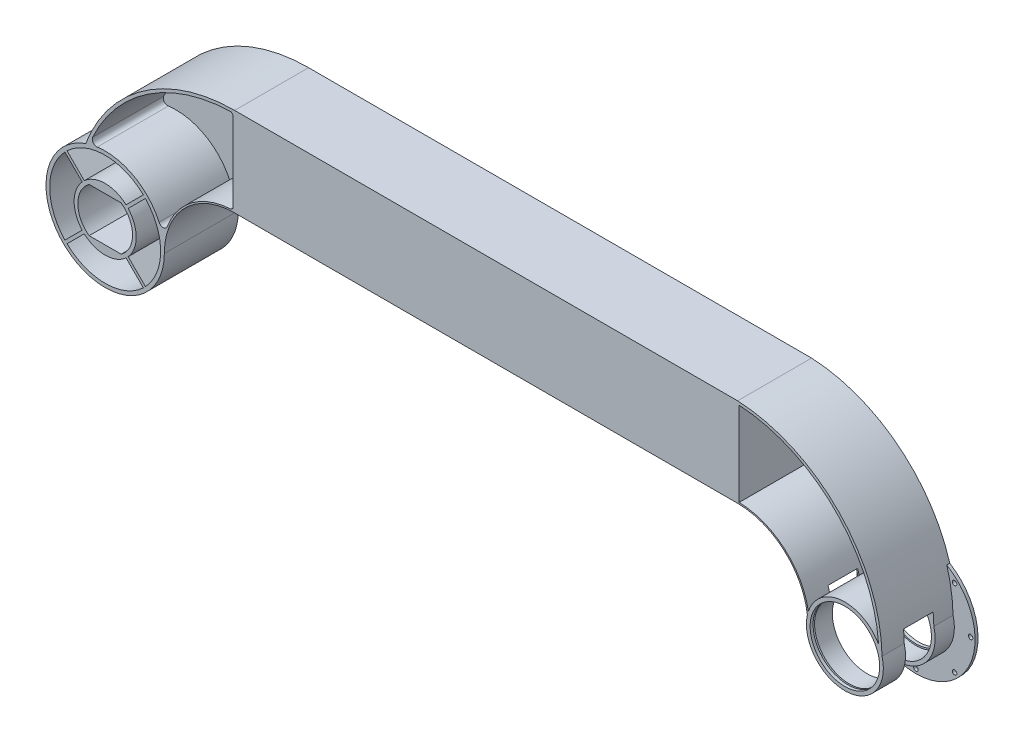
from build123d import *
from build123d.topology import SkipClean

# Parameters (mm, degrees)
BOSS_EXTRUDE1_DEPTH             = 1
BOSS_EXTRUDE2_DEPTH             = 25
SKETCH1_11_R                    = 40
SKETCH1_11_R_2                  = 37.5
SKETCH1_11_R_3                  = 21
BOSS_EXTRUDE3_DEPTH             = 2
SKETCH1_12_R                    = 21
SKETCH1_12_R_2                  = 15
BOSS_EXTRUDE4_DEPTH             = 25
SKETCH1_13_R                    = 40
SKETCH1_13_R_2                  = 37.5
BOSS_EXTRUDE5_DEPTH             = 25
BOSS_EXTRUDE6_START             = -2
SKETCH1_14_R                    = 40
SKETCH1_14_R_2                  = 21
BOSS_EXTRUDE6_DEPTH             = 3
SKETCH1_15_R                    = 23.5
SKETCH1_15_R_2                  = 21
BOSS_EXTRUDE7_DEPTH             = 14
SKETCH1_16_R                    = 40
SKETCH1_16_R_2                  = 23.5
BOSS_EXTRUDE8_DEPTH             = 14
SKETCH1_17_R                    = 37.5
SKETCH1_17_R_2                  = 21
CUT_EXTRUDE1_DEPTH              = 2
SKETCH3_R                       = 31
CUT_EXTRUDE2_DEPTH              = 22
CUT_EXTRUDE4_START              = 1
CUT_EXTRUDE4_DEPTH              = 1
BOSS_EXTRUDE9_START             = 50
BOSS_EXTRUDE9_DEPTH             = 50
BOSS_EXTRUDE10_START            = 50
BOSS_EXTRUDE10_DEPTH            = 50
CUT_EXTRUDE8_DEPTH              = 60
CUT_EXTRUDE8_DEPTH_BACK         = 60
SKETCH6_W                       = 248.929499316
SKETCH6_H                       = 245.601683372
SKETCH7_R                       = 23.5
BOSS_EXTRUDE11_DEPTH            = 50
SKETCH7_23_W                    = 340
SKETCH7_23_H                    = 57
BOSS_EXTRUDE12_DEPTH            = 1
SKETCH10_W                      = 1
SKETCH10_H                      = 57
BOSS_EXTRUDE13_DEPTH            = 15
BOSS_EXTRUDE14_DEPTH            = 2
CUT_EXTRUDE9_START              = 62
CUT_EXTRUDE9_DEPTH              = 62
BOSS_EXTRUDE15_START            = 2
BOSS_EXTRUDE15_DEPTH            = 2
SKETCH7_27_R                    = 37.5
SKETCH7_27_R_2                  = 21
CUT_EXTRUDE10_DEPTH             = 60
SKETCH7_28_R                    = 37.5
SKETCH7_28_R_2                  = 21
BOSS_EXTRUDE16_DEPTH            = 2
FILLET7_R                       = 3
FILLET8_R                       = 2
RIB2_START                      = -48
RIB2_DEPTH                      = 48
SKETCH16_R                      = 5
CUT_EXTRUDE12_DEPTH             = 10
SKETCH17_R                      = 40
SKETCH17_R_2                    = 22.5
BOSS_EXTRUDE17_DEPTH            = 2
SKETCH24_R                      = 26
SKETCH24_R_2                    = 23.5
BOSS_EXTRUDE18_DEPTH            = 50
F_3_0MM_DOWEL_HOLE2_D           = 3
F_3_0MM_DOWEL_HOLE2_CSINK_D     = 3.05
F_3_0MM_DOWEL_HOLE2_CSINK_ANGLE = 90
CUT_EXTRUDE13_DEPTH             = 50
CUT_EXTRUDE11_DEPTH             = 15
CUT_EXTRUDE11_DEPTH_BACK        = 40
SKETCH11_W                      = 120
SKETCH11_H                      = 20
SKETCH25_R                      = 25
CUT_EXTRUDE14_DEPTH             = 1


# Read off the part's stored shape, not the designer's step: Rib2
with BuildPart() as part:
    # Sketch1 → Boss-Extrude1 (new body)
    with BuildSketch(Plane.XY):
        with BuildLine():
            ThreePointArc((87.5, 105.5), (28.068160961, 87.167118275), (-10.708571429, 38.539933808))
            ThreePointArc((-10.708571429, 38.539933808), (21.483664092, 33.740956969), (39.451428571, 6.601877284))
            ThreePointArc((39.451428571, 6.601877284), (55.624782732, 36.554350277), (87.5, 48.5))
            Line((87.5, 48.5), (412.5, 48.5))
            ThreePointArc((412.5, 48.5), (444.375217268, 36.554350277), (460.548571429, 6.601877284))
            ThreePointArc((460.548571429, 6.601877284), (478.516335908, 33.740956969), (510.708571429, 38.539933808))
            ThreePointArc((510.708571429, 38.539933808), (471.931839039, 87.167118275), (412.5, 105.5))
            Line((412.5, 105.5), (87.5, 105.5))
        make_face()
        with BuildLine():
            ThreePointArc((39.451428571, 6.601877284), (39.862621231, 3.312314685), (40, 0))
            ThreePointArc((40, 0), (53.912427894, 33.587572106), (87.5, 47.5))
            Line((87.5, 47.5), (412.5, 47.5))
            ThreePointArc((412.5, 47.5), (446.087572106, 33.587572106), (460, 0))
            ThreePointArc((460, 0), (460.137378769, 3.312314685), (460.548571429, 6.601877284))
            ThreePointArc((460.548571429, 6.601877284), (444.375217268, 36.554350277), (412.5, 48.5))
            Line((412.5, 48.5), (87.5, 48.5))
            ThreePointArc((87.5, 48.5), (55.624782732, 36.554350277), (39.451428571, 6.601877284))
        make_face()
    boss_extrude1 = extrude(amount=BOSS_EXTRUDE1_DEPTH)

    # Sketch1<10> → Boss-Extrude2 (add)
    with BuildSketch(Plane.XY):
        with BuildLine():
            Line((412.5, 107.5), (87.5, 107.5))
            ThreePointArc((87.5, 107.5), (26.283214045, 88.367160854), (-13.142857143, 37.779164974))
            ThreePointArc((-13.142857143, 37.779164974), (-11.931779144, 38.178955545), (-10.708571429, 38.539933808))
            ThreePointArc((-10.708571429, 38.539933808), (28.068160961, 87.167118275), (87.5, 105.5))
            Line((87.5, 105.5), (412.5, 105.5))
            ThreePointArc((412.5, 105.5), (471.931839039, 87.167118275), (510.708571429, 38.539933808))
            ThreePointArc((510.708571429, 38.539933808), (511.931779144, 38.178955545), (513.142857143, 37.779164974))
            ThreePointArc((513.142857143, 37.779164974), (473.716785955, 88.367160854), (412.5, 107.5))
        make_face()
        with BuildLine():
            ThreePointArc((39.451428571, 6.601877284), (39.862621231, 3.312314685), (40, 0))
            ThreePointArc((40, 0), (53.912427894, 33.587572106), (87.5, 47.5))
            Line((87.5, 47.5), (412.5, 47.5))
            ThreePointArc((412.5, 47.5), (446.087572106, 33.587572106), (460, 0))
            ThreePointArc((460, 0), (460.137378769, 3.312314685), (460.548571429, 6.601877284))
            ThreePointArc((460.548571429, 6.601877284), (444.375217268, 36.554350277), (412.5, 48.5))
            Line((412.5, 48.5), (87.5, 48.5))
            ThreePointArc((87.5, 48.5), (55.624782732, 36.554350277), (39.451428571, 6.601877284))
        make_face()
    boss_extrude2 = extrude(amount=BOSS_EXTRUDE2_DEPTH)

    # Sketch1<11> → Boss-Extrude3 (add)
    # profile 1 of 2: a face of its own
    with BuildSketch(Plane.XY):
        Circle(SKETCH1_11_R)
        Circle(SKETCH1_11_R_2, mode=Mode.SUBTRACT)
    # profile 2 of 2: a face of its own
    with BuildSketch(Plane.XY):
        Circle(SKETCH1_11_R_2)
        Circle(SKETCH1_11_R_3, mode=Mode.SUBTRACT)
    boss_extrude3 = extrude(amount=BOSS_EXTRUDE3_DEPTH)

    # Sketch1<12> → Boss-Extrude4 (add)
    with BuildSketch(Plane.XY):
        Circle(SKETCH1_12_R)
        Circle(SKETCH1_12_R_2, mode=Mode.SUBTRACT)
    boss_extrude4 = extrude(amount=BOSS_EXTRUDE4_DEPTH)

    # Sketch1<13> → Boss-Extrude5 (add)
    with BuildSketch(Plane.XY):
        Circle(SKETCH1_13_R)
        Circle(SKETCH1_13_R_2, mode=Mode.SUBTRACT)
    boss_extrude5 = extrude(amount=BOSS_EXTRUDE5_DEPTH)

    # Sketch1<14> → Boss-Extrude6 (add)
    with BuildSketch(Plane.XY.offset(BOSS_EXTRUDE6_START)):
        with Locations((500, 0)):
            Circle(SKETCH1_14_R)
        with Locations((500, 0)):
            Circle(SKETCH1_14_R_2, mode=Mode.SUBTRACT)
    boss_extrude6 = extrude(amount=BOSS_EXTRUDE6_DEPTH)

    # Sketch1<15> → Boss-Extrude7 (add)
    with BuildSketch(Plane.XY):
        with Locations((500, 0)):
            Circle(SKETCH1_15_R)
        with Locations((500, 0)):
            Circle(SKETCH1_15_R_2, mode=Mode.SUBTRACT)
    boss_extrude7 = extrude(amount=BOSS_EXTRUDE7_DEPTH)

    # Sketch1<16> → Boss-Extrude8 (add)
    with BuildSketch(Plane.XY):
        with Locations((500, 0)):
            Circle(SKETCH1_16_R)
        with Locations((500, 0)):
            Circle(SKETCH1_16_R_2, mode=Mode.SUBTRACT)
    boss_extrude8 = extrude(amount=BOSS_EXTRUDE8_DEPTH)

    # Mirror1: Boss-Extrude2, Boss-Extrude3, Boss-Extrude4, Boss-Extrude5, Boss-Extrude6, Boss-Extrude7, Boss-Extrude8 across plane
    add(boss_extrude2.mirror(Plane.XY.offset(25)))
    add(boss_extrude3.mirror(Plane.XY.offset(25)))
    add(boss_extrude4.mirror(Plane.XY.offset(25)))
    add(boss_extrude5.mirror(Plane.XY.offset(25)))
    add(boss_extrude6.mirror(Plane.XY.offset(25)))
    add(boss_extrude7.mirror(Plane.XY.offset(25)))
    add(boss_extrude8.mirror(Plane.XY.offset(25)))

    # Mirror2: Boss-Extrude1 across plane
    add(boss_extrude1.mirror(Plane.XY.offset(25)))

    # Sketch1<17> → Cut-Extrude1 (cut)
    with BuildSketch(Plane.XY):
        with Locations(Location((0, 0, 0), (0, 0, 180))):
            Circle(SKETCH1_17_R)
        with Locations(Location((0, 0, 0), (0, 0, 180))):
            Circle(SKETCH1_17_R_2, mode=Mode.SUBTRACT)
    extrude(amount=CUT_EXTRUDE1_DEPTH, mode=Mode.SUBTRACT)

    # Sketch3 → Cut-Extrude2 (cut)
    with BuildSketch(Plane.XY):
        with Locations((500, 0)):
            Circle(SKETCH3_R)
    extrude(amount=CUT_EXTRUDE2_DEPTH, mode=Mode.SUBTRACT)

    # Sketch5 → Cut-Extrude4 (cut)
    with BuildSketch(Plane.XY.offset(CUT_EXTRUDE4_START)):
        with BuildLine():
            ThreePointArc((510.708571429, 38.539933808), (472.344290507, 86.884468657), (413.5, 105.495260557))
            Line((413.5, 105.495260557), (413.5, 48.489689626))
            ThreePointArc((413.5, 48.489689626), (444.750392176, 36.223779545), (460.548571429, 6.601877284))
            ThreePointArc((460.548571429, 6.601877284), (478.516335908, 33.740956969), (510.708571429, 38.539933808))
        make_face()
        with BuildLine():
            ThreePointArc((86.5, 105.495260557), (27.655709493, 86.884468657), (-10.708571429, 38.539933808))
            ThreePointArc((-10.708571429, 38.539933808), (21.483664092, 33.740956969), (39.451428571, 6.601877284))
            ThreePointArc((39.451428571, 6.601877284), (55.249607824, 36.223779545), (86.5, 48.489689626))
            Line((86.5, 48.489689626), (86.5, 105.495260557))
        make_face()
    extrude(amount=-CUT_EXTRUDE4_DEPTH, mode=Mode.SUBTRACT)

    # Sketch5<19> → Boss-Extrude9 (add)
    with BuildSketch(Plane.XY.offset(BOSS_EXTRUDE9_START)):
        with BuildLine():
            Line((87.5, 48.5), (87.5, 105.5))
            ThreePointArc((87.5, 105.5), (86.999994384, 105.498815133), (86.5, 105.495260557))
            Line((86.5, 105.495260557), (86.5, 48.489689626))
            ThreePointArc((86.5, 48.489689626), (86.999973425, 48.497422338), (87.5, 48.5))
        make_face()
        with BuildLine():
            ThreePointArc((413.5, 105.495260557), (413.000005616, 105.498815133), (412.5, 105.5))
            Line((412.5, 105.5), (412.5, 48.5))
            ThreePointArc((412.5, 48.5), (413.000026575, 48.497422338), (413.5, 48.489689626))
            Line((413.5, 48.489689626), (413.5, 105.495260557))
        make_face()
    extrude(amount=-BOSS_EXTRUDE9_DEPTH)

    # Sketch1<18> → Boss-Extrude10 (add)
    with BuildSketch(Plane.XY.offset(BOSS_EXTRUDE10_START)):
        with BuildLine():
            Line((-7.483314774, 13), (0, 13))
            Line((0, 13), (7.483314774, 13))
            ThreePointArc((7.483314774, 13), (0, 15), (-7.483314774, 13))
        make_face()
        with BuildLine():
            Line((0, -13), (-7.483314774, -13))
            ThreePointArc((-7.483314774, -13), (0, -15), (7.483314774, -13))
            Line((7.483314774, -13), (0, -13))
        make_face()
    extrude(amount=-BOSS_EXTRUDE10_DEPTH)

    # Sketch6 → Cut-Extrude8 (cut, two sides: drawn at the far end of the back side and taken through both)
    with BuildSketch(Plane.XY.offset(-CUT_EXTRUDE8_DEPTH_BACK)):
        with Locations((536.964749658, 15.651167598)):
            Rectangle(SKETCH6_W, SKETCH6_H)
    extrude(amount=CUT_EXTRUDE8_DEPTH + CUT_EXTRUDE8_DEPTH_BACK, mode=Mode.SUBTRACT)

    # Sketch7 → Boss-Extrude11 (add)
    with BuildSketch(Plane.XY):
        with BuildLine():
            Line((427.5, 107.5), (412.5, 107.5))
            Line((412.5, 107.5), (412.5, 105.5))
            Line((412.5, 105.5), (427.5, 105.5))
            Line((427.5, 105.5), (427.5, 48.5))
            Line((427.5, 48.5), (412.5, 48.5))
            Line((412.5, 48.5), (412.5, 47.5))
            Line((412.5, 47.5), (427.5, 47.5))
            ThreePointArc((427.5, 47.5), (461.087572106, 33.587572106), (475, 0))
            ThreePointArc((475, 0), (500, -25), (525, 0))
            ThreePointArc((525, 0), (498.513978978, 73.942911166), (427.5, 107.5))
        make_face()
        with BuildLine():
            ThreePointArc((523.011089442, 9.771886344), (497.865985258, 24.908753102), (475.662068966, 5.715340144))
            ThreePointArc((475.662068966, 5.715340144), (460.082794534, 35.925081772), (428.5, 48.489689626))
            Line((428.5, 48.489689626), (428.5, 105.445258723))
            ThreePointArc((428.5, 105.445258723), (494.085624179, 75.715969985), (523.011089442, 9.771886344))
        make_face(mode=Mode.SUBTRACT)
        with Locations((500, 0)):
            Circle(SKETCH7_R, mode=Mode.SUBTRACT)
    extrude(amount=BOSS_EXTRUDE11_DEPTH)

    # Sketch7<23> → Boss-Extrude12 (add)
    with BuildSketch(Plane.XY):
        with Locations((257.5, 77)):
            Rectangle(SKETCH7_23_W, SKETCH7_23_H)
        with BuildLine():
            Line((428.5, 48.489689626), (428.5, 105.445258723))
            ThreePointArc((428.5, 105.445258723), (428.000068104, 105.473873474), (427.5, 105.5))
            Line((427.5, 105.5), (427.5, 48.5))
            ThreePointArc((427.5, 48.5), (428.000026575, 48.497422338), (428.5, 48.489689626))
        make_face()
    extrude(amount=BOSS_EXTRUDE12_DEPTH)

    # Sketch10 → Boss-Extrude13 (add)
    with BuildSketch(Plane(origin=(412.5, 0, 0), x_dir=(0, 0, -1), z_dir=(1, 0, 0))):
        with Locations((-49.5, 77)):
            Rectangle(SKETCH10_W, SKETCH10_H)
    extrude(amount=BOSS_EXTRUDE13_DEPTH)

    # Sketch7<24> → Boss-Extrude14 (add)
    with BuildSketch(Plane.XY):
        with BuildLine():
            ThreePointArc((475.662068966, 5.715340144), (497.865985258, 24.908753102), (523.011089442, 9.771886344))
            ThreePointArc((523.011089442, 9.771886344), (494.085624179, 75.715969985), (428.5, 105.445258723))
            Line((428.5, 105.445258723), (428.5, 48.489689626))
            ThreePointArc((428.5, 48.489689626), (460.082794534, 35.925081772), (475.662068966, 5.715340144))
        make_face()
    extrude(amount=BOSS_EXTRUDE14_DEPTH)

    # Sketch7<25> → Cut-Extrude9 (cut)
    with BuildSketch(Plane.XY.offset(CUT_EXTRUDE9_START)):
        with BuildLine():
            ThreePointArc((86.5, 105.495260557), (27.655709493, 86.884468657), (-10.708571429, 38.539933808))
            ThreePointArc((-10.708571429, 38.539933808), (21.483664092, 33.740956969), (39.451428571, 6.601877284))
            ThreePointArc((39.451428571, 6.601877284), (55.249607824, 36.223779545), (86.5, 48.489689626))
            Line((86.5, 48.489689626), (86.5, 105.495260557))
        make_face()
    extrude(amount=-CUT_EXTRUDE9_DEPTH, mode=Mode.SUBTRACT)

    # Sketch7<26> → Boss-Extrude15 (add)
    with BuildSketch(Plane.XY.offset(BOSS_EXTRUDE15_START)):
        with BuildLine():
            ThreePointArc((86.5, 105.495260557), (27.655709493, 86.884468657), (-10.708571429, 38.539933808))
            ThreePointArc((-10.708571429, 38.539933808), (21.483664092, 33.740956969), (39.451428571, 6.601877284))
            ThreePointArc((39.451428571, 6.601877284), (55.249607824, 36.223779545), (86.5, 48.489689626))
            Line((86.5, 48.489689626), (86.5, 105.495260557))
        make_face()
    extrude(amount=-BOSS_EXTRUDE15_DEPTH)

    # Sketch7<27> → Cut-Extrude10 (cut)
    with SkipClean():  # the faces are left unmerged after this step: merging them gives an invalid solid
        with BuildSketch(Plane.XY):
            with Locations(Location((0, 0, 0), (0, 0, 180))):
                Circle(SKETCH7_27_R)
            with Locations(Location((0, 0, 0), (0, 0, 180))):
                Circle(SKETCH7_27_R_2, mode=Mode.SUBTRACT)
        extrude(amount=CUT_EXTRUDE10_DEPTH, mode=Mode.SUBTRACT)
    add(part.part.scale(1), mode=Mode.REPLACE)  # the faces are merged on a copy


with BuildPart() as cut_extrude10_piece_1:
    # of the separate pieces the step leaves, piece 1, a body of its own (cut_extrude10_pieces)
    add(part.part.solids().sort_by_distance((87.5, 107.5, 50))[0])



with BuildPart() as cut_extrude10_piece_2:
    # of the separate pieces the step leaves, piece 2, a body of its own (cut_extrude10_pieces)
    add(part.part.solids().sort_by_distance((-21, 0, 50))[0])


with BuildPart() as cut_extrude10_piece_1_1:
    add(cut_extrude10_piece_1.part)

    add(cut_extrude10_piece_2.part)  # Boss-Extrude16 merges Cut-Extrude10 piece 2
    # Sketch7<28> → Boss-Extrude16 (add)
    with BuildSketch(Plane.XY):
        with Locations(Location((0, 0, 0), (0, 0, 180))):
            Circle(SKETCH7_28_R)
        with Locations(Location((0, 0, 0), (0, 0, 180))):
            Circle(SKETCH7_28_R_2, mode=Mode.SUBTRACT)
    extrude(amount=BOSS_EXTRUDE16_DEPTH)

    # Fillet7
    fillet7_edges = [cut_extrude10_piece_1_1.edges().sort_by_distance(p)[0] for p in [
        (-10.708571429, 38.539933808, 26),
        (39.451428571, 6.601877284, 26),
    ]]
    fillet(fillet7_edges, radius=FILLET7_R)

    # Fillet8
    fillet8_edges = [cut_extrude10_piece_1_1.edges().sort_by_distance(p)[0] for p in [
        (86.5, 48.489689626, 26),
        (86.5, 105.495260557, 26),
    ]]
    fillet(fillet8_edges, radius=FILLET8_R)

    # Rib2 outline → Rib2 (add)
    with BuildSketch(Plane.XY.offset(50).offset(RIB2_START)):
        with BuildLine():
            ThreePointArc((-25.799967746, 27.214181309), (-26.516504294, 26.516504294), (-27.214181309, 25.799967746))
            Line((-27.214181309, 25.799967746), (-15.539503755, 14.125290193))
            ThreePointArc((-15.539503755, 14.125290193), (-14.849242405, 14.849242405), (-14.125290193, 15.539503755))
            Line((-14.125290193, 15.539503755), (-25.799967746, 27.214181309))
        make_face()
        with BuildLine():
            Line((-15.539503755, -14.125290193), (-27.214181309, -25.799967746))
            ThreePointArc((-27.214181309, -25.799967746), (-26.516504294, -26.516504294), (-25.799967746, -27.214181309))
            Line((-25.799967746, -27.214181309), (-14.125290193, -15.539503755))
            ThreePointArc((-14.125290193, -15.539503755), (-14.849242405, -14.849242405), (-15.539503755, -14.125290193))
        make_face()
        with BuildLine():
            ThreePointArc((27.214181309, 25.799967746), (26.516504294, 26.516504294), (25.799967746, 27.214181309))
            Line((25.799967746, 27.214181309), (14.125290193, 15.539503755))
            ThreePointArc((14.125290193, 15.539503755), (14.849242405, 14.849242405), (15.539503755, 14.125290193))
            Line((15.539503755, 14.125290193), (27.214181309, 25.799967746))
        make_face()
        with BuildLine():
            Line((14.125290193, -15.539503755), (25.799967746, -27.214181309))
            ThreePointArc((25.799967746, -27.214181309), (26.516504294, -26.516504294), (27.214181309, -25.799967746))
            Line((27.214181309, -25.799967746), (15.539503755, -14.125290193))
            ThreePointArc((15.539503755, -14.125290193), (14.849242405, -14.849242405), (14.125290193, -15.539503755))
        make_face()
    extrude(amount=RIB2_DEPTH)

    # Sketch15 → Ø3.0mm Dowel Hole1 (revolve, cut)
    with BuildSketch(Plane(origin=(0, -13, 25), x_dir=(0, 0, 1), z_dir=(1, 0, 0))):
        Polygon((0, 0), (0, 35.901290929), (1.5, 35), (1.5, 0.025), (1.525, 0), align=None)
    revolve(axis=Axis((0, -6.65, 25), (0, -1, 0)), mode=Mode.SUBTRACT)

    # Sketch16 → Cut-Extrude12 (cut)
    with BuildSketch(Plane(origin=(0, -43, 0), x_dir=(1, 0, 0), z_dir=(0, 1, 0))):
        with Locations(Location((0, -25, 0), (0, 0, 90))):
            Circle(SKETCH16_R)
    extrude(amount=CUT_EXTRUDE12_DEPTH, mode=Mode.SUBTRACT)

    # Sketch17 → Boss-Extrude17 (add)
    with BuildSketch(Plane(origin=(0, 0, 0), x_dir=(-1, 0, 0), z_dir=(0, 0, -1))):
        with Locations((-500, 0)):
            Circle(SKETCH17_R)
        with Locations((-500, 0)):
            Circle(SKETCH17_R_2, mode=Mode.SUBTRACT)
    extrude(amount=-BOSS_EXTRUDE17_DEPTH)

    # Sketch24 → Boss-Extrude18 (add)
    with BuildSketch(Plane(origin=(0, 0, 0), x_dir=(-1, 0, 0), z_dir=(0, 0, -1))):
        with Locations((-500, 0)):
            Circle(SKETCH24_R)
        with Locations((-500, 0)):
            Circle(SKETCH24_R_2, mode=Mode.SUBTRACT)
    extrude(amount=-BOSS_EXTRUDE18_DEPTH)

    # Ø3.0mm Dowel Hole2 (through all)
    with Locations(Plane(origin=(0, 0, 0), x_dir=(-1, 0, 0), z_dir=(0, 0, -1))):
        with Locations((-500, 37), (-473.837049096, 26.162950904), (-463, 0), (-526.162950904, 26.162950904), (-537, 0), (-526.162950904, -26.162950904), (-500, -37), (-473.837049096, -26.162950904)):
            CounterSinkHole(F_3_0MM_DOWEL_HOLE2_D / 2, F_3_0MM_DOWEL_HOLE2_CSINK_D / 2, counter_sink_angle=F_3_0MM_DOWEL_HOLE2_CSINK_ANGLE)

    # Sketch23 → Cut-Extrude13 (cut)
    with BuildSketch(Plane.XY.offset(50)):
        with BuildLine():
            Line((10.828203914, 15), (0, 15))
            Line((0, 15), (-10.828203914, 15))
            ThreePointArc((-10.828203914, 15), (-18.5, 0), (-10.828203914, -15))
            Line((-10.828203914, -15), (0, -15))
            Line((0, -15), (10.828203914, -15))
            ThreePointArc((10.828203914, -15), (16.470758519, -8.42402005), (18.5, 0))
            ThreePointArc((18.5, 0), (16.470758519, 8.42402005), (10.828203914, 15))
        make_face()
    extrude(amount=-CUT_EXTRUDE13_DEPTH, mode=Mode.SUBTRACT)

    # Sketch11 → Cut-Extrude11 (cut, two sides: drawn at the far end of the back side and taken through both)
    with BuildSketch(Plane(origin=(0, 0, 0), x_dir=(1, 0, 0), z_dir=(0, 1, 0)).offset(-CUT_EXTRUDE11_DEPTH_BACK)):
        with Locations((525.121878759, -25)):
            Rectangle(SKETCH11_W, SKETCH11_H)
    extrude(amount=CUT_EXTRUDE11_DEPTH + CUT_EXTRUDE11_DEPTH_BACK, mode=Mode.SUBTRACT)

    # Sketch25 → Cut-Extrude14 (cut)
    with BuildSketch(Plane.XY.offset(47)):
        with Locations((500, 0)):
            Circle(SKETCH25_R)
    extrude(amount=CUT_EXTRUDE14_DEPTH, mode=Mode.SUBTRACT)


solid = cut_extrude10_piece_1_1.part
